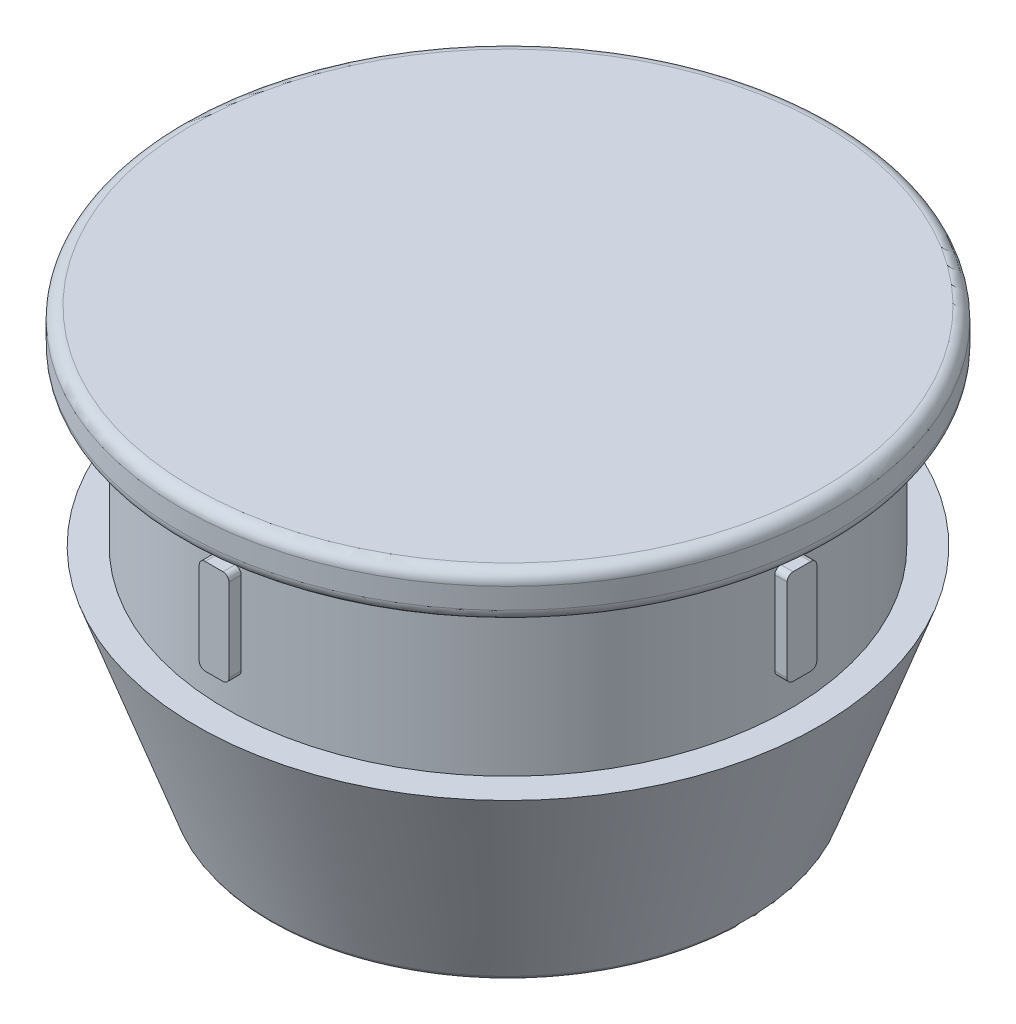
from build123d import *

# Parameters (mm, degrees)
SKETCH2_W                = 1.27
SKETCH2_H                = 4.064
BOSS_EXTRUDE1_DEPTH      = 3.048
FILLET1_R                = 0.508
FILLET2_R                = 0.254
CIRPATTERN1_COUNT        = 4
FILLET2_OF_CIRPATTERN1_R = 0.254


with BuildPart() as part:
    # Sketch1 → Revolve1 (revolve)
    with BuildSketch(Plane.XY):
        Polygon((13.335, -6.985), (10.16, -15.875), (9.525, -15.875), (9.525, 0), (0, 0), (0, 1.905), (13.97, 1.905), (13.97, 0), (12.065, 0), (12.065, -6.985), align=None)
    revolve(axis=Axis((0, 0, 0), (0, 1, 0)))

    # Sketch2 → Boss-Extrude1 (add)
    with BuildSketch(Plane.ZY.offset(-9.525)):
        with Locations((0, -3.4925)):
            Rectangle(SKETCH2_W, SKETCH2_H)
    boss_extrude1 = extrude(amount=-BOSS_EXTRUDE1_DEPTH)

    # Fillet1
    fillet1_edges = [part.edges().sort_by_distance(p)[0] for p in [
        (-13.97, 1.905, 0),
        (-13.97, 0, 0),
        (-9.525, 0, 0),
        (-12.065, 0, 0),
    ]]
    fillet(fillet1_edges, radius=FILLET1_R)

    # Fillet2
    fillet2_edges = [part.edges().sort_by_distance(p)[0] for p in [
        (-9.525, -15.875, 0),
        (-10.16, -15.875, 0),
        (12.310638943, -5.5245, 0.635),
        (12.310638943, -1.4605, 0.635),
        (12.310638943, -1.4605, -0.635),
        (12.310638943, -5.5245, -0.635),
    ]]
    fillet(fillet2_edges, radius=FILLET2_R)

    # CirPattern1: Boss-Extrude1 ×4 about axis
    cirpattern1_axis = Axis((0, 0, 0), (0, -1, 0))
    for i in range(1, CIRPATTERN1_COUNT):
        add(boss_extrude1.rotate(cirpattern1_axis, i * 360 / CIRPATTERN1_COUNT))

    # Fillet2 of CirPattern1
    fillet2_of_cirpattern1_edges = [part.edges().sort_by_distance(p)[0] for p in [
        (0, -15.875, -9.525),
        (0, -15.875, -10.16),
        (-0.635, -5.5245, 12.310638943),
        (-0.635, -1.4605, 12.310638943),
        (0.635, -1.4605, 12.310638943),
        (0.635, -5.5245, 12.310638943),
        (9.525, -15.875, 0),
        (10.16, -15.875, 0),
        (-12.310638943, -5.5245, -0.635),
        (-12.310638943, -1.4605, -0.635),
        (-12.310638943, -1.4605, 0.635),
        (-12.310638943, -5.5245, 0.635),
        (0, -15.875, 9.525),
        (0, -15.875, 10.16),
        (0.635, -5.5245, -12.310638943),
        (0.635, -1.4605, -12.310638943),
        (-0.635, -1.4605, -12.310638943),
        (-0.635, -5.5245, -12.310638943),
    ]]
    fillet(fillet2_of_cirpattern1_edges, radius=FILLET2_OF_CIRPATTERN1_R)


solid = part.part
